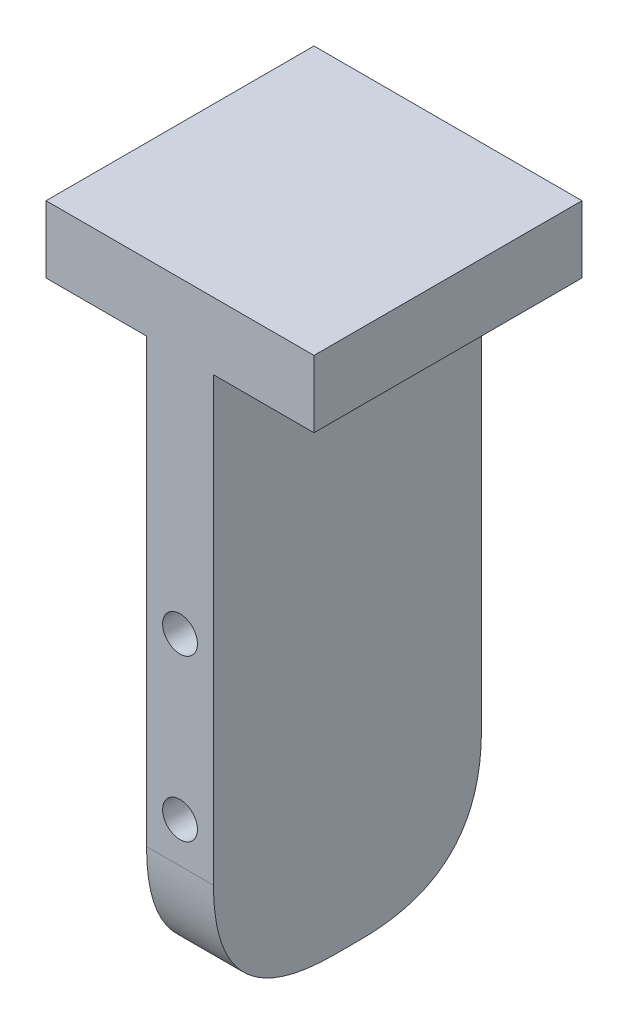
from build123d import *

# Parameters (mm, degrees)
SKETCH_1_W           = 20
SKETCH_1_H           = 20
EXTRUDE_1_DEPTH      = 5
SKETCH_2_W           = 5
SKETCH_2_H           = 20
EXTRUDE_2_DEPTH      = 35
F_1_0MM_1_AT_2_COUNT = 2
F_1_0MM_1_AT_2_PITCH = 12
SKETCH_5_W           = 5
SKETCH_5_H           = 20
EXTRUDE_3_DEPTH      = 7
FILLET_1_SIZE        = 9


with BuildPart() as part:
    # 草圖1 → 填料-伸長1 (new body)
    with BuildSketch(Plane(origin=(0, 0, 0), x_dir=(1, 0, 0), z_dir=(0, 1, 0))):
        Rectangle(SKETCH_1_W, SKETCH_1_H)
    extrude(amount=EXTRUDE_1_DEPTH)

    # 草圖2 → 填料-伸長2 (add)
    with BuildSketch(Plane.XZ):
        Rectangle(SKETCH_2_W, SKETCH_2_H)
    extrude(amount=EXTRUDE_2_DEPTH)

    # 草圖4 → Ø1.0mm 定位孔1 (revolve, cut)
    with BuildSketch(Plane(origin=(0, -18, 10), x_dir=(0, -1, 0), z_dir=(1, 0, 0))):
        Polygon((0, 0), (0, 7.281118805), (1.3, 6.5), (1.3, 0), align=None)
    f_1_0mm_1 = revolve(axis=Axis((0, -18, 16.35), (0, 0, -1)), mode=Mode.SUBTRACT)

    # Ø1.0mm 定位孔1 at 2: Ø1.0mm 定位孔1 ×2
    with Locations(*[(0, -i * F_1_0MM_1_AT_2_PITCH, 0) for i in range(1, F_1_0MM_1_AT_2_COUNT)]):
        add(f_1_0mm_1, mode=Mode.SUBTRACT)

    # 鏡射1: Ø1.0mm 定位孔1 across plane
    add(f_1_0mm_1.mirror(Plane.XY), mode=Mode.SUBTRACT)

    # 鏡射1 copy 1 sketch → 鏡射1 copy 1 (revolve, cut)
    with BuildSketch(Plane(origin=(0, -30, -10), x_dir=(0, -1, 0), z_dir=(1, 0, 0))):
        Polygon((0, 0), (0, -7.281118805), (1.3, -6.5), (1.3, 0), align=None)
    revolve(axis=Axis((0, -30, -16.35), (0, 0, -1)), mode=Mode.SUBTRACT)

    # 草圖5 → 填料-伸長3 (add)
    with BuildSketch(Plane.XZ.offset(35)):
        Rectangle(SKETCH_5_W, SKETCH_5_H)
    extrude(amount=EXTRUDE_3_DEPTH)

    # 圓角1
    # a fillet whose section is not a circle: 9 mm, written as the material it takes off along each edge
    with BuildSketch(Plane(origin=(-25, -42, 10), x_dir=(0, 1, 0), z_dir=(1, 0, 0)), Plane(origin=(25, -42, -10), x_dir=(0, 1, 0), z_dir=(-1, 0, 0))) as fillet_1_piece_1:
        with BuildLine():
            Bezier((FILLET_1_SIZE, 0), (0, 0), (0, -FILLET_1_SIZE), weights=[1, 1, 1])
            Line((0, -FILLET_1_SIZE), (0, 0))
            Line((0, 0), (FILLET_1_SIZE, 0))
        make_face()
    extrude(amount=50, mode=Mode.SUBTRACT)


solid = part.part
